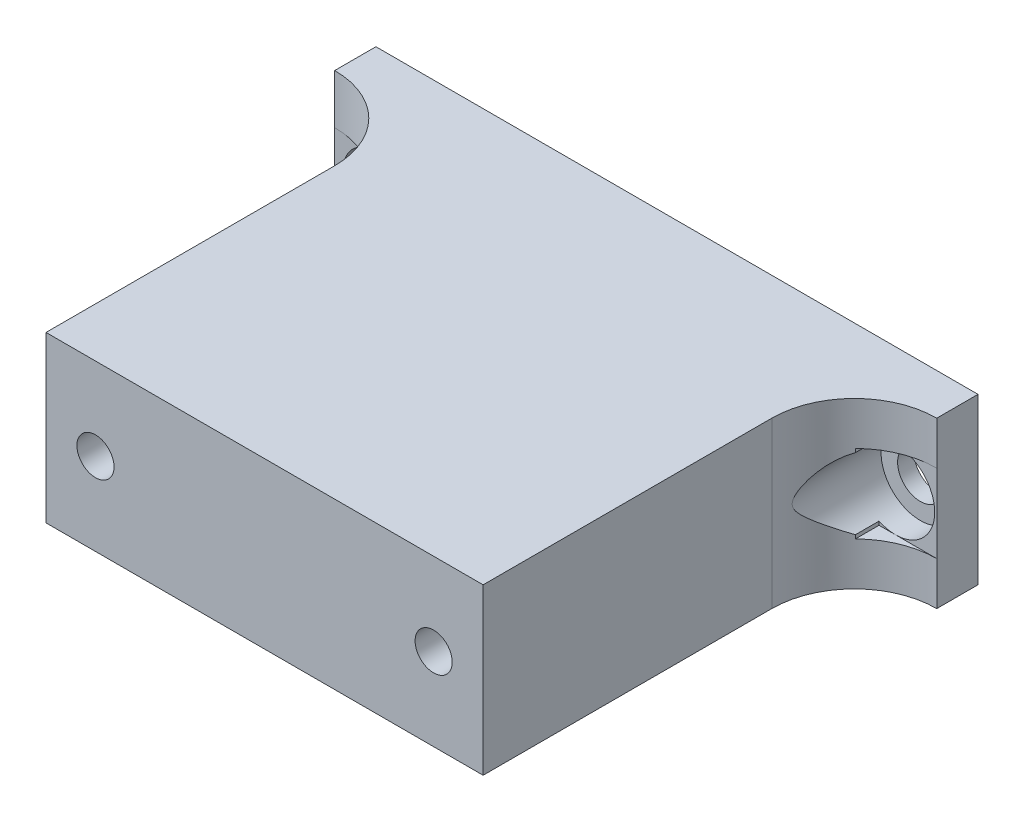
from build123d import *

# Parameters (mm, degrees)
SKETCH_1_W                     = 53
SKETCH_1_H                     = 20
EXTRUDE_1_DEPTH                = 50
HOLE_WIZARD_M5_1_D             = 4.5
HOLE_WIZARD_M5_1_DEPTH         = 45
HOLE_WIZARD_M5_1_TIP           = 1.351936393
SKETCH_4_W                     = 5
SKETCH_4_H                     = 20
EXTRUDE_2_DEPTH                = 20
HOLE_WIZARD_M4_1_D             = 4.5
HOLE_WIZARD_M4_1_DEPTH         = 15
HOLE_WIZARD_M4_1_CBORE_D       = 8
HOLE_WIZARD_M4_1_CBORE_DEPTH   = 3
HOLE_WIZARD_M4_1_TIP           = 1.351936393
SKETCH_7_W                     = 5
SKETCH_7_H                     = 20
EXTRUDE_3_DEPTH                = 20
HOLE_WIZARD_M5_1_2_D           = 5.5
HOLE_WIZARD_M5_1_2_DEPTH       = 15
HOLE_WIZARD_M5_1_2_CBORE_D     = 9.5
HOLE_WIZARD_M5_1_2_CBORE_DEPTH = 3
HOLE_WIZARD_M5_1_2_TIP         = 1.652366702
FILLET_1_R                     = 10
SKETCH_10_W                    = 6
SKETCH_10_H                    = 8
SKETCH_10_W_2                  = 7
SKETCH_10_H_2                  = 9.5
CUT_EXTRUDE_1_DEPTH            = 20
SKETCH_11_W                    = 10
SKETCH_11_H                    = 20
CUT_EXTRUDE_2_DEPTH            = 10


with BuildPart() as part:
    # 스케치1 → 보스-돌출1 (new body)
    with BuildSketch(Plane.XY):
        Rectangle(SKETCH_1_W, SKETCH_1_H)
    extrude(amount=EXTRUDE_1_DEPTH)

    # Hole Wizard M5 _ _1
    with Locations(Plane.XY.offset(50)):
        with Locations((20.5, 0), (-20.5, 0)):
            Hole(HOLE_WIZARD_M5_1_D / 2, depth=HOLE_WIZARD_M5_1_DEPTH)
            with Locations((0, 0, -(HOLE_WIZARD_M5_1_DEPTH + HOLE_WIZARD_M5_1_TIP / 2))):  # 118° drill point
                Cone(0, HOLE_WIZARD_M5_1_D / 2, HOLE_WIZARD_M5_1_TIP, mode=Mode.SUBTRACT)

    # 스케치4 → 보스-돌출2 (add)
    with BuildSketch(Plane.ZY.offset(26.5)):
        with Locations((2.5, 0)):
            Rectangle(SKETCH_4_W, SKETCH_4_H)
    extrude(amount=EXTRUDE_2_DEPTH)

    # M4 소켓 머리 캡 나사용 카운터보어1
    with Locations(Plane.XY.offset(5)):
        with Locations((-31.5, 0)):
            CounterBoreHole(HOLE_WIZARD_M4_1_D / 2, HOLE_WIZARD_M4_1_CBORE_D / 2, HOLE_WIZARD_M4_1_CBORE_DEPTH, depth=HOLE_WIZARD_M4_1_DEPTH)
            with Locations((0, 0, -(HOLE_WIZARD_M4_1_DEPTH + HOLE_WIZARD_M4_1_TIP / 2))):  # 118° drill point
                Cone(0, HOLE_WIZARD_M4_1_D / 2, HOLE_WIZARD_M4_1_TIP, mode=Mode.SUBTRACT)

    # 스케치7 → 보스-돌출3 (add)
    with BuildSketch(Plane(origin=(26.5, 0, 0), x_dir=(0, 0, -1), z_dir=(1, 0, 0))):
        with Locations((-2.5, 0)):
            Rectangle(SKETCH_7_W, SKETCH_7_H)
    extrude(amount=EXTRUDE_3_DEPTH)

    # Hole Wizard M5 _ _ _ _ _1 2
    with Locations(Plane.XY.offset(5)):
        with Locations((31.5, 0)):
            CounterBoreHole(HOLE_WIZARD_M5_1_2_D / 2, HOLE_WIZARD_M5_1_2_CBORE_D / 2, HOLE_WIZARD_M5_1_2_CBORE_DEPTH, depth=HOLE_WIZARD_M5_1_2_DEPTH)
            with Locations((0, 0, -(HOLE_WIZARD_M5_1_2_DEPTH + HOLE_WIZARD_M5_1_2_TIP / 2))):  # 118° drill point
                Cone(0, HOLE_WIZARD_M5_1_2_D / 2, HOLE_WIZARD_M5_1_2_TIP, mode=Mode.SUBTRACT)

    # 필렛1
    # the kernel refuses this fillet: 10 mm, written as the material it adds along each edge
    with BuildSketch(Plane(origin=(-26.5, 10, 5), x_dir=(0, 0, 1), z_dir=(0, -1, 0))) as fillet_1_piece_1_section:
        with BuildLine():
            CenterArc((FILLET_1_R, FILLET_1_R), FILLET_1_R, 180, 90)
            Line((0, FILLET_1_R), (0, 0))
            Line((0, 0), (FILLET_1_R, 0))
        make_face()
    fillet_1_piece_1 = extrude(amount=20, mode=Mode.PRIVATE)
    fillet_1_piece_1 = fillet_1_piece_1 - Plane(origin=(-31.5, 0, 12.39249306), x_dir=(1, 0, 0), z_dir=(0, 0, 1)) * Cylinder(4, 81, mode=Mode.PRIVATE)
    add(fillet_1_piece_1)
    with BuildSketch(Plane(origin=(26.5, 10, 5), x_dir=(0, 0, 1), z_dir=(0, -1, 0))) as fillet_1_piece_2_section:
        with BuildLine():
            CenterArc((FILLET_1_R, -FILLET_1_R), FILLET_1_R, 90, 90)
            Line((0, -FILLET_1_R), (0, 0))
            Line((0, 0), (FILLET_1_R, 0))
        make_face()
    fillet_1_piece_2 = extrude(amount=20, mode=Mode.PRIVATE)
    fillet_1_piece_2 = fillet_1_piece_2 - Plane(origin=(31.5, 0, 12.393306283), x_dir=(1, 0, 0), z_dir=(0, 0, 1)) * Cylinder(4.75, 80, mode=Mode.PRIVATE)
    add(fillet_1_piece_2)

    # 스케치10 → 컷-돌출1 (cut)
    with BuildSketch(Plane.XY.offset(5)):
        with Locations((-33.5, 0)):
            Rectangle(SKETCH_10_W, SKETCH_10_H)
        with Locations((33, 0)):
            Rectangle(SKETCH_10_W_2, SKETCH_10_H_2)
    extrude(amount=CUT_EXTRUDE_1_DEPTH, mode=Mode.SUBTRACT)

    # 스케치11 → 컷-돌출2 (cut)
    with BuildSketch(Plane.XY.offset(5)):
        with Locations((-41.5, 0)):
            Rectangle(SKETCH_11_W, SKETCH_11_H)
        with Locations((41.5, 0)):
            Rectangle(SKETCH_11_W, SKETCH_11_H)
    extrude(amount=-CUT_EXTRUDE_2_DEPTH, mode=Mode.SUBTRACT)


solid = part.part
